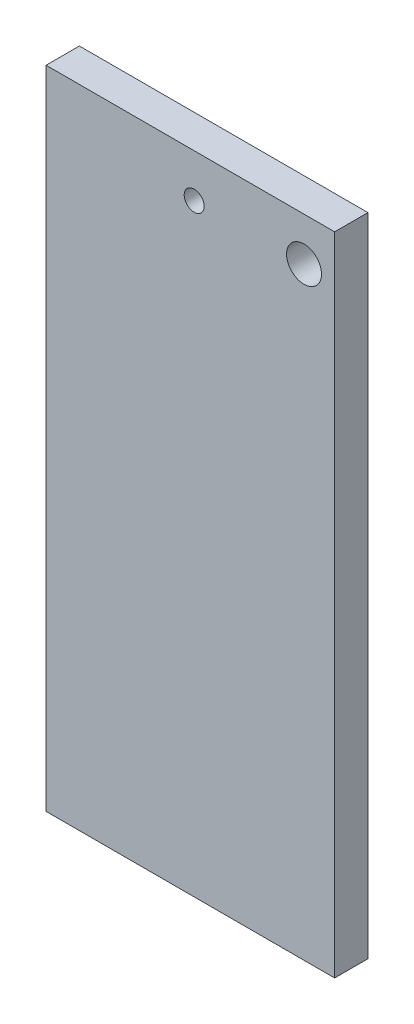
from build123d import *

# Parameters (mm, degrees)
SKETCH1_W           = 86.683733235
SKETCH1_H           = 194.138919348
SKETCH1_R           = 3
SKETCH1_R_2         = 5.25
BOSS_EXTRUDE2_DEPTH = 10


with BuildPart() as part:
    # Sketch1 → Boss-Extrude2 (new body)
    with BuildSketch(Plane.XY):
        with Locations((20.599224535, -84.069459674)):
            Rectangle(SKETCH1_W, SKETCH1_H)
        with Locations((21.75, 0)):
            Circle(SKETCH1_R, mode=Mode.SUBTRACT)
        with Locations((54.75, 0)):
            Circle(SKETCH1_R_2, mode=Mode.SUBTRACT)
    extrude(amount=BOSS_EXTRUDE2_DEPTH)


solid = part.part
